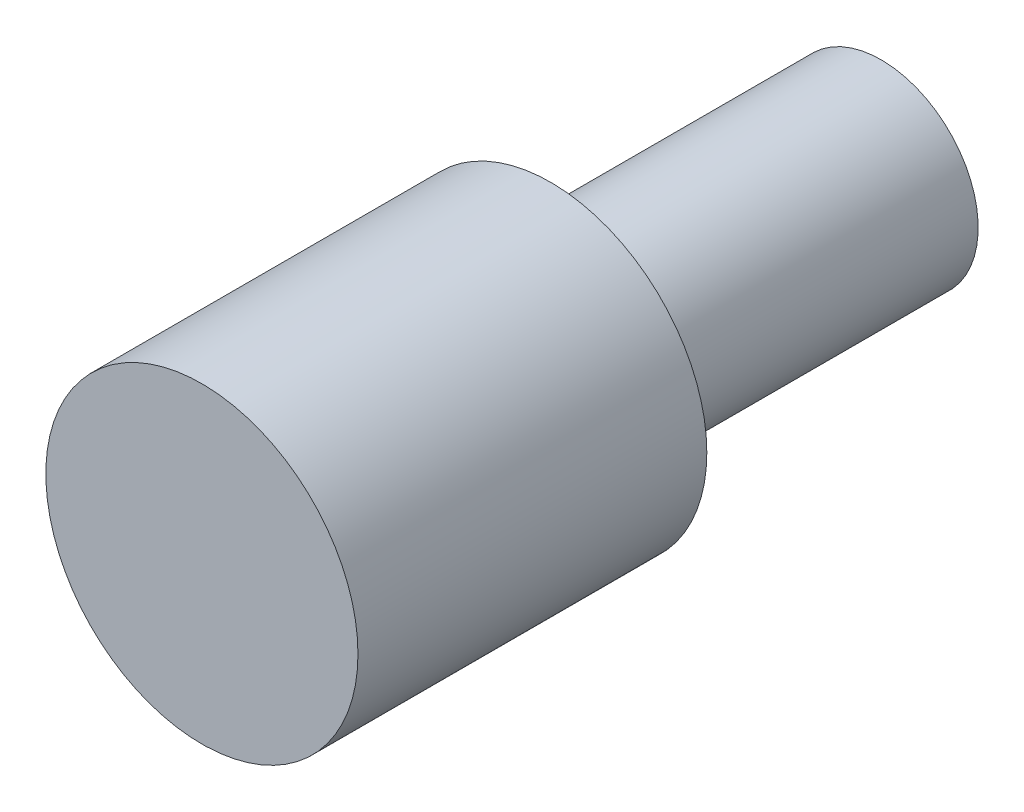
from build123d import *

# Parameters (mm, degrees)
SKETCH_1_R      = 7.65
EXTRUDE_1_DEPTH = 17.1
SKETCH_3_R      = 4.75
EXTRUDE_2_DEPTH = 16.2


with BuildPart() as part:
    # 草图1 → 凸台-拉伸1 (new body)
    with BuildSketch(Plane.XY):
        Circle(SKETCH_1_R)
    extrude(amount=EXTRUDE_1_DEPTH)

    # 草图3 → 凸台-拉伸2 (add)
    with BuildSketch(Plane(origin=(0, 0, 0), x_dir=(-1, 0, 0), z_dir=(0, 0, -1))):
        Circle(SKETCH_3_R)
    extrude(amount=EXTRUDE_2_DEPTH)


solid = part.part
